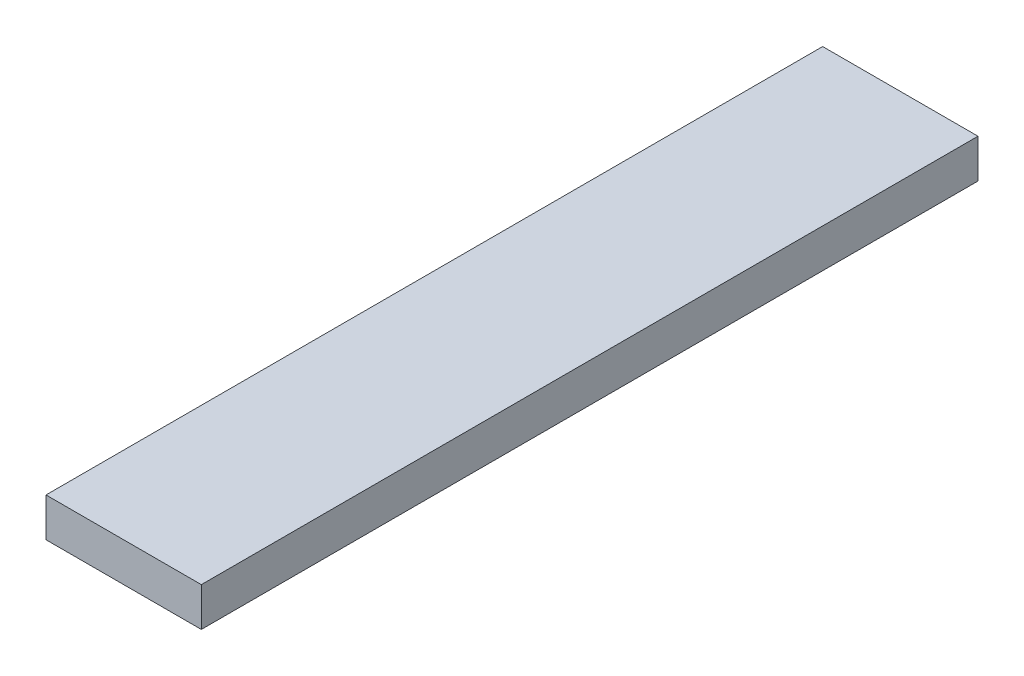
from build123d import *

# Parameters (mm, degrees)
SKETCH1_W           = 25.4
SKETCH1_H           = 127
BOSS_EXTRUDE1_DEPTH = 6.35


with BuildPart() as part:
    # Sketch1 → Boss-Extrude1 (new body)
    with BuildSketch(Plane(origin=(0, 0, 0), x_dir=(1, 0, 0), z_dir=(0, 1, 0))):
        Rectangle(SKETCH1_W, SKETCH1_H)
    extrude(amount=BOSS_EXTRUDE1_DEPTH)


solid = part.part
